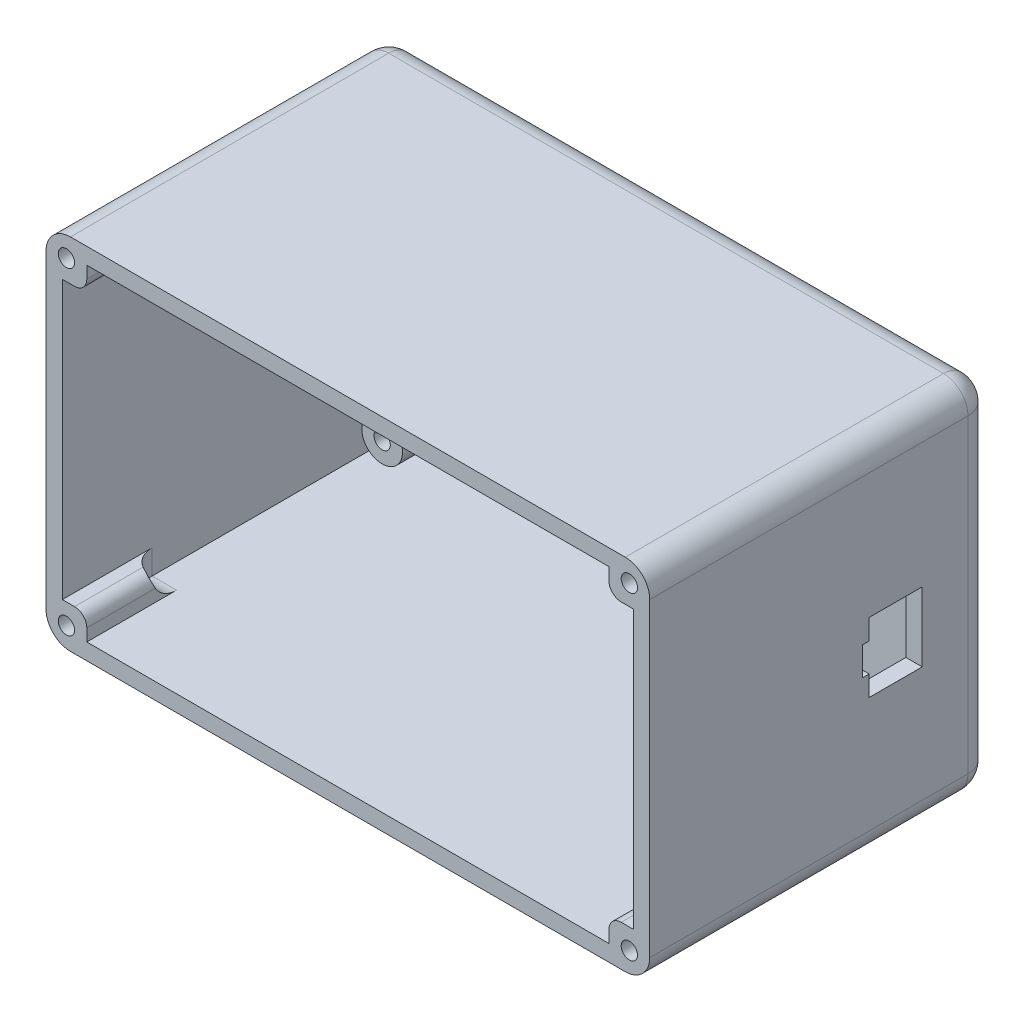
from build123d import *

# Parameters (mm, degrees)
IZIM1_W                     = 70
IZIM1_H                     = 40
Y_KSEKLIK_EKSTR_ZYON1_DEPTH = 40
BO_ALTMA2_T                 = 2
IZIM2_R                     = 2.5
IZIM2_R_2                   = 1
Y_KSEKLIK_EKSTR_ZYON2_DEPTH = 5
RADYUS2_R                   = 3
KES_EKSTR_ZYON1_DEPTH       = 5
KES_EKSTR_ZYON2_DEPTH       = 5
IZIM5_W                     = 3
IZIM5_H                     = 3
Y_KSEKLIK_EKSTR_ZYON3_DEPTH = 8
RADYUS3_R                   = 3
IZIM6_R                     = 1
KES_EKSTR_ZYON3_DEPTH       = 8
RADYUS4_R                   = 1.5


# Some blends are built 0.0001 mm under size
with BuildPart() as part:
    # Çizim1 → Yükseklik-Ekstrüzyon1 (new body)
    with BuildSketch(Plane.XY):
        Rectangle(IZIM1_W, IZIM1_H)
    extrude(amount=Y_KSEKLIK_EKSTR_ZYON1_DEPTH)

    # İç Boşaltma2
    bo_altma2_openings = [part.faces().sort_by_distance(p)[0] for p in [
        (0, 0, 40),
    ]]
    offset(amount=BO_ALTMA2_T, openings=bo_altma2_openings, kind=Kind.INTERSECTION)

    # Çizim2 → Yükseklik-Ekstrüzyon2 (add)
    # profile 1 of 4: a face of its own
    with BuildSketch(Plane.XY):
        with Locations((-30.8, 15.5)):
            Circle(IZIM2_R)
        with Locations((-30.8, 15.5)):
            Circle(IZIM2_R_2, mode=Mode.SUBTRACT)
    # profile 2 of 4: a face of its own
    with BuildSketch(Plane.XY):
        with Locations((-30.8, -15.5)):
            Circle(IZIM2_R)
        with Locations((-30.8, -15.5)):
            Circle(IZIM2_R_2, mode=Mode.SUBTRACT)
    # profile 3 of 4: a face of its own
    with BuildSketch(Plane.XY):
        with Locations((30.8, -15.5)):
            Circle(IZIM2_R)
        with Locations((30.8, -15.5)):
            Circle(IZIM2_R_2, mode=Mode.SUBTRACT)
    # profile 4 of 4: a face of its own
    with BuildSketch(Plane.XY):
        with Locations((30.8, 15.5)):
            Circle(IZIM2_R)
        with Locations((30.8, 15.5)):
            Circle(IZIM2_R_2, mode=Mode.SUBTRACT)
    extrude(amount=Y_KSEKLIK_EKSTR_ZYON2_DEPTH)

    # Radyus2
    radyus2_edges = [part.edges().sort_by_distance(p)[0] for p in [
        (0, -22, -2),
        (-37, 0, -2),
        (0, 22, -2),
        (37, 0, -2),
        (37, -22, 19),
        (-37, -22, 19),
        (-37, 22, 19),
        (37, 22, 19),
    ]]
    fillet(radyus2_edges, radius=RADYUS2_R)

    # Çizim3 → Kes-Ekstrüzyon1 (cut)
    with BuildSketch(Plane.ZY.offset(37)):
        Polygon((6.6, 3.36), (13.1, 3.36), (13.1, 0.86), (13.9, 0.86), (13.9, -2.64), (13.1, -2.64), (13.1, -5.14), (6.6, -5.14), align=None)
    extrude(amount=-KES_EKSTR_ZYON1_DEPTH, mode=Mode.SUBTRACT)

    # Çizim4 → Kes-Ekstrüzyon2 (cut)
    with BuildSketch(Plane(origin=(37, 0, 0), x_dir=(0, 0, -1), z_dir=(1, 0, 0))):
        Polygon((-13.1, -2.34), (-13.9, -2.34), (-13.9, 1.16), (-13.1, 1.16), (-13.1, 3.66), (-6.6, 3.66), (-6.6, -4.84), (-13.1, -4.84), align=None)
    extrude(amount=-KES_EKSTR_ZYON2_DEPTH, mode=Mode.SUBTRACT)

    # Çizim5 → Yükseklik-Ekstrüzyon3 (add)
    with BuildSketch(Plane.XY.offset(40)):
        with Locations((-33.5, 18.5)):
            Rectangle(IZIM5_W, IZIM5_H)
        with Locations((-33.5, -18.5)):
            Rectangle(IZIM5_W, IZIM5_H)
        with Locations((33.5, 18.5)):
            Rectangle(IZIM5_W, IZIM5_H)
        with Locations((33.5, -18.5)):
            Rectangle(IZIM5_W, IZIM5_H)
    extrude(amount=-Y_KSEKLIK_EKSTR_ZYON3_DEPTH)

    # Radyus3
    radyus3_edges = [part.edges().sort_by_distance(p)[0] for p in [
        (33.5, 20, 32),
        (35, 18.5, 32),
        (33.5, -20, 32),
        (35, -18.5, 32),
        (-35, -18.5, 32),
        (-33.5, -20, 32),
        (-33.5, 20, 32),
        (-35, 18.5, 32),
    ]]
    fillet(radyus3_edges, radius=RADYUS3_R - 0.0001)  # a hair under: the kernel refuses the full size

    # Çizim6 → Kes-Ekstrüzyon3 (cut)
    with BuildSketch(Plane.XY.offset(40)):
        with Locations((-34.5, 19.5)):
            Circle(IZIM6_R)
        with Locations((-34.5, -19.5)):
            Circle(IZIM6_R)
        with Locations((34.5, -19.5)):
            Circle(IZIM6_R)
        with Locations((34.5, 19.5)):
            Circle(IZIM6_R)
    extrude(amount=-KES_EKSTR_ZYON3_DEPTH, mode=Mode.SUBTRACT)

    # Radyus4
    # the kernel refuses this fillet: 1.5 mm, written as the material it takes off along each edge
    with BuildSketch(Plane(origin=(-32, -17, 43.75), x_dir=(-1, 0, 0), z_dir=(0, 0, -1)), Plane(origin=(-32, 17, 43.75), x_dir=(0, 1, 0), z_dir=(0, 0, -1))) as radyus4_piece_1:
        with BuildLine():
            CenterArc((RADYUS4_R, -RADYUS4_R), RADYUS4_R, 90, 90)
            Line((0, -RADYUS4_R), (0, 0))
            Line((0, 0), (RADYUS4_R, 0))
        make_face()
    extrude(amount=15.5, mode=Mode.SUBTRACT)
    with BuildSketch(Plane(origin=(32, -17, 43.75), x_dir=(1, 0, 0), z_dir=(0, 0, -1)), Plane(origin=(32, 17, 43.75), x_dir=(0, 1, 0), z_dir=(0, 0, -1))) as radyus4_piece_2:
        with BuildLine():
            CenterArc((RADYUS4_R, RADYUS4_R), RADYUS4_R, 180, 90)
            Line((0, RADYUS4_R), (0, 0))
            Line((0, 0), (RADYUS4_R, 0))
        make_face()
    extrude(amount=15.5, mode=Mode.SUBTRACT)


solid = part.part
